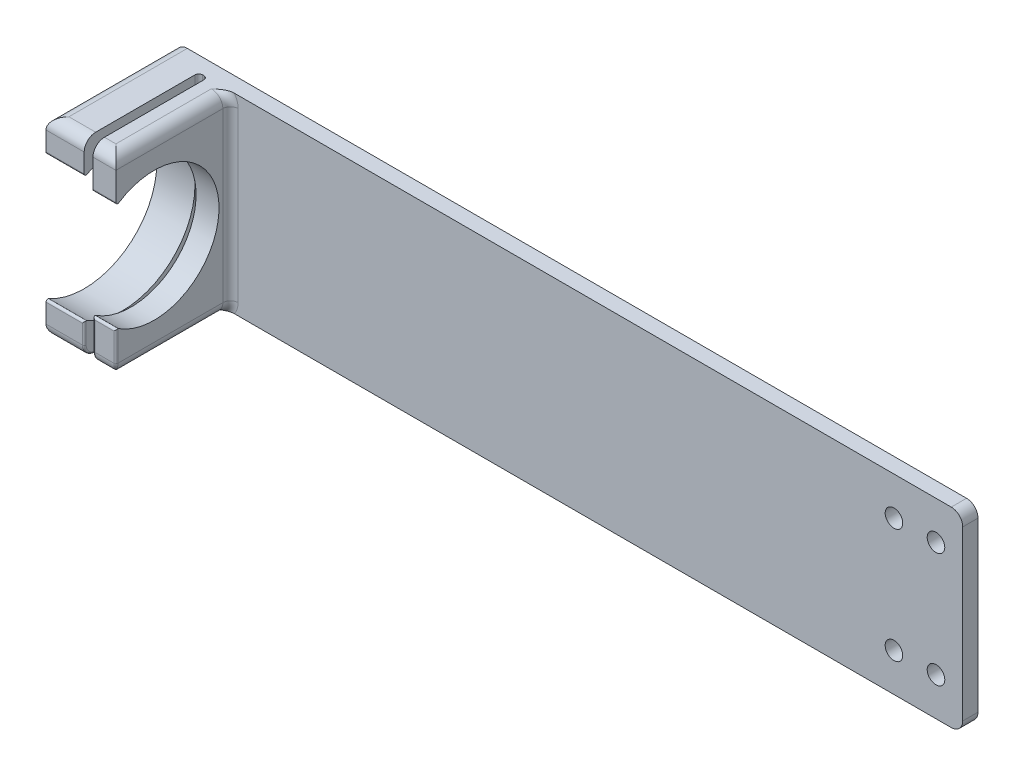
from build123d import *

# Parameters (mm, degrees)
SKETCH_1_W                      = 210
SKETCH_1_H                      = 50
EXTRUDE_1_DEPTH                 = 4
CUT_EXTRUDE_1_REACH             = 217.907
SKETCH_4_R                      = 2.3
CUT_EXTRUDE_1_DIRECTION_2_DEPTH = 216.907387553
EXTRUDE_2_DEPTH                 = 10
EXTRUDE_3_DEPTH                 = 6
FILLET_1_R                      = 3
FILLET_2_R                      = 2
FILLET_3_R                      = 1
FILLET_4_R                      = 0.5


# Some blends are built 0.0001 mm under size
with BuildPart() as part:
    # ｽｹｯﾁ1 → ﾎﾞｽ - 押し出し1 (new body)
    with BuildSketch(Plane.XY):
        with Locations((-105, 25)):
            Rectangle(SKETCH_1_W, SKETCH_1_H)
    extrude(amount=EXTRUDE_1_DEPTH)

    # ｽｹｯﾁ4 → ｶｯﾄ - 押し出し1 (cut, up to next)
    with BuildSketch(Plane.XY.offset(4), mode=Mode.PRIVATE) as cut_extrude_1_sk1:
        with Locations(Location((-7, 40, 0), (0, 0, 180))):
            Circle(SKETCH_4_R)
    cut_extrude_1_tool1 = extrude(cut_extrude_1_sk1.sketch, amount=-CUT_EXTRUDE_1_REACH, mode=Mode.PRIVATE) & part.part
    # ｽｹｯﾁ4 → ｶｯﾄ - 押し出し1 (cut, up to next)
    with BuildSketch(Plane.XY.offset(4), mode=Mode.PRIVATE) as cut_extrude_1_sk2:
        with Locations(Location((-18, 40, 0), (0, 0, 180))):
            Circle(SKETCH_4_R)
    cut_extrude_1_tool2 = extrude(cut_extrude_1_sk2.sketch, amount=-CUT_EXTRUDE_1_REACH, mode=Mode.PRIVATE) & part.part
    # ｽｹｯﾁ4 → ｶｯﾄ - 押し出し1 (cut, up to next)
    with BuildSketch(Plane.XY.offset(4), mode=Mode.PRIVATE) as cut_extrude_1_sk3:
        with Locations(Location((-7, 10, 0), (0, 0, 180))):
            Circle(SKETCH_4_R)
    cut_extrude_1_tool3 = extrude(cut_extrude_1_sk3.sketch, amount=-CUT_EXTRUDE_1_REACH, mode=Mode.PRIVATE) & part.part
    # ｽｹｯﾁ4 → ｶｯﾄ - 押し出し1 (cut, up to next)
    with BuildSketch(Plane.XY.offset(4), mode=Mode.PRIVATE) as cut_extrude_1_sk4:
        with Locations(Location((-18, 10, 0), (0, 0, 180))):
            Circle(SKETCH_4_R)
    cut_extrude_1_tool4 = extrude(cut_extrude_1_sk4.sketch, amount=-CUT_EXTRUDE_1_REACH, mode=Mode.PRIVATE) & part.part
    add(cut_extrude_1_tool1.solids().sort_by_distance((-7, 40, 4))[0], mode=Mode.SUBTRACT)
    add(cut_extrude_1_tool2.solids().sort_by_distance((-18, 40, 4))[0], mode=Mode.SUBTRACT)
    add(cut_extrude_1_tool3.solids().sort_by_distance((-7, 10, 4))[0], mode=Mode.SUBTRACT)
    add(cut_extrude_1_tool4.solids().sort_by_distance((-18, 10, 4))[0], mode=Mode.SUBTRACT)

    # ｽｹｯﾁ4 → ｶｯﾄ - 押し出し1 direction 2 (cut)
    with BuildSketch(Plane.XY.offset(4)):
        with Locations(Location((-7, 40, 0), (0, 0, 180))):
            Circle(SKETCH_4_R)
        with Locations(Location((-18, 40, 0), (0, 0, 180))):
            Circle(SKETCH_4_R)
        with Locations(Location((-7, 10, 0), (0, 0, 180))):
            Circle(SKETCH_4_R)
        with Locations(Location((-18, 10, 0), (0, 0, 180))):
            Circle(SKETCH_4_R)
    extrude(amount=CUT_EXTRUDE_1_DIRECTION_2_DEPTH, mode=Mode.SUBTRACT)

    # ｽｹｯﾁ5 → ﾎﾞｽ - 押し出し2 (add)
    with BuildSketch(Plane.ZY.offset(210)):
        with BuildLine():
            Line((34, 50), (4, 50))
            Line((4, 50), (4, 0))
            Line((4, 0), (34, 0))
            Line((34, 0), (34, 8.844505579))
            ThreePointArc((34, 8.844505579), (5, 25), (34, 41.155494421))
            Line((34, 41.155494421), (34, 50))
        make_face()
    extrude(amount=-EXTRUDE_2_DEPTH)

    # ｽｹｯﾁ6 → ﾎﾞｽ - 押し出し3 (add)
    with BuildSketch(Plane(origin=(-197.7, 0, 0), x_dir=(0, 0, -1), z_dir=(1, 0, 0))):
        with BuildLine():
            Line((-4, 50), (-34, 50))
            Line((-34, 50), (-34, 38.747727085))
            ThreePointArc((-34, 38.747727085), (-16.28637569, 40.149257408), (-7, 25))
            ThreePointArc((-7, 25), (-16.28637569, 9.850742592), (-34, 11.252272915))
            Line((-34, 11.252272915), (-34, 0))
            Line((-34, 0), (-4, 0))
            Line((-4, 0), (-4, 50))
        make_face()
    extrude(amount=EXTRUDE_3_DEPTH)

    # ﾌｨﾚｯﾄ1
    fillet_1_edges = [part.edges().sort_by_distance(p)[0] for p in [
        (-205, 0, 34),
        (-205, 50, 34),
        (-194.7, 0, 34),
        (-191.7, 50, 19),
        (-194.7, 50, 34),
        (-191.7, 0, 19),
        (0, 0, 2),
        (-210, 0, 17),
        (-210, 50, 17),
        (0, 50, 2),
    ]]
    fillet(fillet_1_edges, radius=FILLET_1_R)

    # ﾌｨﾚｯﾄ2
    # the kernel refuses this fillet: 2 mm, written as the material it adds along each edge
    with BuildSketch(Plane(origin=(-191.7, 3, 4), x_dir=(0, 0, 1), z_dir=(0, 1, 0))) as fillet_2_piece_1:
        with BuildLine():
            CenterArc((FILLET_2_R, FILLET_2_R), FILLET_2_R, 180, 90)
            Line((0, FILLET_2_R), (0, 0))
            Line((0, 0), (FILLET_2_R, 0))
        make_face()
    extrude(amount=44)
    with BuildSketch(Plane(origin=(-194.7, 3, 4), x_dir=(-0.9953436464450918, 0.0963899656675329, 0), z_dir=(0.0963899656675329, 0.9953436464450918, 0))) as fillet_2_piece_2_section:
        with BuildLine():
            CenterArc((3 + FILLET_2_R, FILLET_2_R), FILLET_2_R, 180, 90)
            Line((3 + FILLET_2_R, 0), (3, 0))
            Line((3, 0), (3, FILLET_2_R))
        make_face()
    fillet_2_piece_2 = revolve(axis=Axis((-194.7, 3, 4), (0, 0, 1)), revolution_arc=185.531326158, mode=Mode.PRIVATE)
    fillet_2_piece_2 = split(fillet_2_piece_2, bisect_by=Plane(origin=(-192.479113514, 0, 4.573600846), z_dir=(0, 1, 0)), keep=Keep.TOP, mode=Mode.PRIVATE)
    fillet_2_piece_2 = split(fillet_2_piece_2, bisect_by=Plane(origin=(-197.7, 0.779113097, 4.573600846), z_dir=(1, 0, 0)), keep=Keep.TOP, mode=Mode.PRIVATE)
    add(fillet_2_piece_2)
    with BuildSketch(Plane(origin=(-194.7, 47, 4), x_dir=(-0.9953436464450918, -0.09638996566753365, 0), z_dir=(0.09638996566753365, -0.9953436464450918, 0))) as fillet_2_piece_3_section:
        with BuildLine():
            CenterArc((3 + FILLET_2_R, -FILLET_2_R), FILLET_2_R, 90, 90)
            Line((3 + FILLET_2_R, 0), (3, 0))
            Line((3, 0), (3, -FILLET_2_R))
        make_face()
    fillet_2_piece_3 = revolve(axis=Axis((-194.7, 47, 4), (0, 0, -1)), revolution_arc=185.531326158, mode=Mode.PRIVATE)
    fillet_2_piece_3 = split(fillet_2_piece_3, bisect_by=Plane(origin=(-192.479113243, 50, 4.573600331), z_dir=(0, -1, 0)), keep=Keep.TOP, mode=Mode.PRIVATE)
    fillet_2_piece_3 = split(fillet_2_piece_3, bisect_by=Plane(origin=(-197.7, 49.22088673, 4.573600331), z_dir=(1, 0, 0)), keep=Keep.TOP, mode=Mode.PRIVATE)
    add(fillet_2_piece_3)

    # ﾌｨﾚｯﾄ3
    fillet_3_edges = [part.edges().sort_by_distance(p)[0] for p in [
        (-200, 25, 4),
        (-197.7, 25, 4),
    ]]
    fillet(fillet_3_edges, radius=FILLET_3_R - 0.0001)  # a hair under: the kernel refuses the full size

    # ﾌｨﾚｯﾄ4
    fillet_4_edges = [part.edges().sort_by_distance(p)[0] for p in [
        (-192.761853278, 0.71011195, 32.938146722),
        (-200, 5.922252789, 34),
        (-200, 0.878679656, 33.121320344),
        (-200, 0, 17.99995),
        (-199.707136071, 0, 4.292863929),
        (-198.85, 0, 4),
        (-197.992863929, 0, 4.292863929),
        (-197.7, 0, 17.99995),
        (-197.7, 0.878679656, 33.121320344),
        (-194.7, 11.252272915, 34),
        (-194.7, 38.747727085, 34),
        (-191.7, 7.126136458, 34),
        (-197.7, 7.126136458, 34),
        (-205, 8.844505579, 34),
        (-205, 41.155494421, 34),
    ]]
    fillet(fillet_4_edges, radius=FILLET_4_R)


solid = part.part
